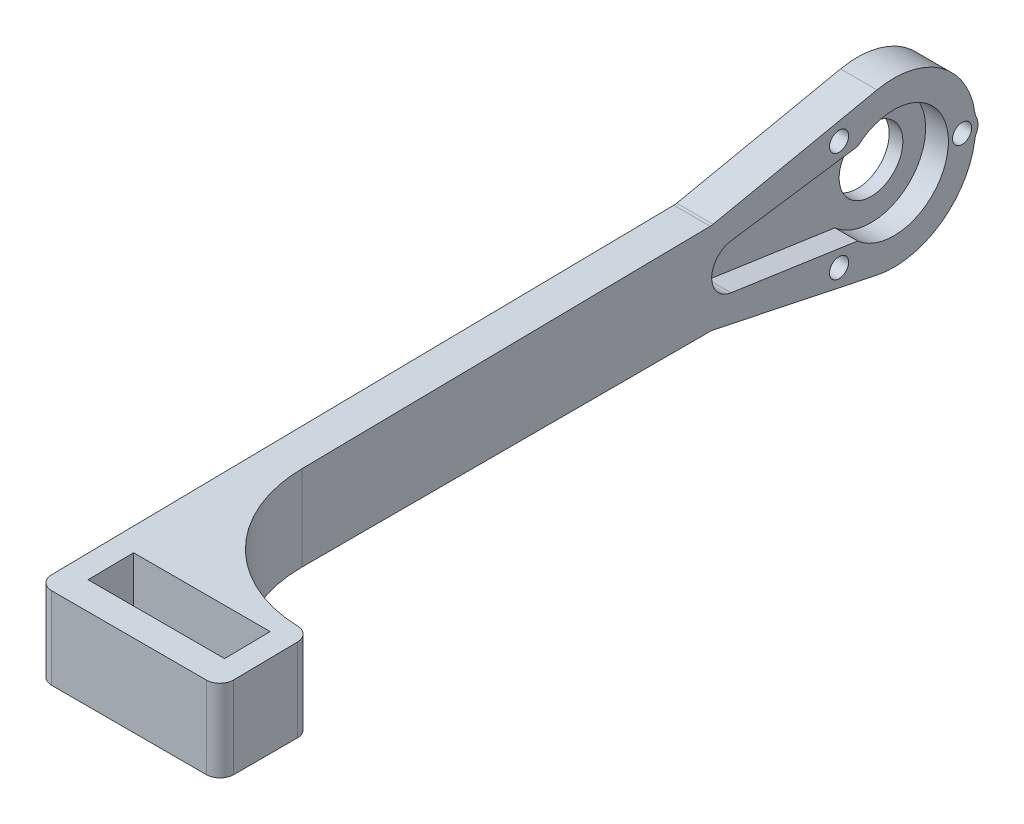
from build123d import *

# Parameters (mm, degrees)
BOSS_EXTRU_1_DEPTH           = 4
ESQUISSE2_R                  = 3.5
ENL_V_MAT_EXTRU_1_DEPTH      = 10
ENL_V_MAT_EXTRU_2_DEPTH      = 2.5
ESQUISSE5_R                  = 1.05
ENL_V_MAT_EXTRU_3_DEPTH      = 61.062987771
ESQUISSE6_W                  = 20
ESQUISSE6_H                  = 10
BOSS_EXTRU_2_DEPTH           = 10
ESQUISSE7_W                  = 15
ESQUISSE7_H                  = 5
ENL_V_MAT_EXTRU_4_DEPTH      = 10
CONG_2_R                     = 1.5
CONG_3_R                     = 15
ENL_V_MAT_EXTRU_5_DEPTH      = 64.178813835
ENL_V_MAT_EXTRU_5_DEPTH_BACK = 64.178813835


with BuildPart() as part:
    # Esquisse1 → Boss.-Extru.1 (new body)
    with BuildSketch(Plane(origin=(0, 0, 0), x_dir=(0, 0, -1), z_dir=(1, 0, 0))):
        with BuildLine():
            Line((30, 5), (-30, 5))
            Line((-30, 5), (-30, -5))
            Line((-30, -5), (30, -5))
            Line((30, -5), (48.152060387, -8.808241549))
            ThreePointArc((48.152060387, -8.808241549), (55.281301679, -7.28751347), (58.945833333, -0.985934061))
            ThreePointArc((58.945833333, -0.985934061), (59.25, 0), (58.945833333, 0.985934061))
            ThreePointArc((58.945833333, 0.985934061), (55.281301679, 7.28751347), (48.152060387, 8.808241549))
            Line((48.152060387, 8.808241549), (30, 5))
        make_face()
    extrude(amount=BOSS_EXTRU_1_DEPTH)

    # Esquisse2 → Enlèv. mat.-Extru.1 (cut)
    with BuildSketch(Plane(origin=(4, 0, 0), x_dir=(0, 0, -1), z_dir=(1, 0, 0))):
        with Locations((50, 0)):
            Circle(ESQUISSE2_R)
    extrude(amount=-ENL_V_MAT_EXTRU_1_DEPTH, mode=Mode.SUBTRACT)

    # Esquisse3 → Enlèv. mat.-Extru.2 (cut)
    with BuildSketch(Plane(origin=(4, 0, 0), x_dir=(0, 0, -1), z_dir=(1, 0, 0))):
        with BuildLine():
            Line((32.139192589, 2.473826593), (46.031373033, 4.5))
            ThreePointArc((46.031373033, 4.5), (56, 0), (46.031373033, -4.5))
            Line((46.031373033, -4.5), (32.139192589, -2.473826593))
            ThreePointArc((32.139192589, -2.473826593), (30, 0), (32.139192589, 2.473826593))
        make_face()
    extrude(amount=-ENL_V_MAT_EXTRU_2_DEPTH, mode=Mode.SUBTRACT)

    # Esquisse5 → Enlèv. mat.-Extru.3 (cut, through all)
    with BuildSketch(Plane(origin=(4, 0, 0), x_dir=(0, 0, -1), z_dir=(1, 0, 0))):
        with Locations((43.98959236, 6.01040764)):
            Circle(ESQUISSE5_R)
        with Locations((43.98959236, -6.01040764)):
            Circle(ESQUISSE5_R)
        with Locations((57.5, 0)):
            Circle(ESQUISSE5_R)
    extrude(amount=-ENL_V_MAT_EXTRU_3_DEPTH, mode=Mode.SUBTRACT)

    # Esquisse6 → Boss.-Extru.2 (add)
    with BuildSketch(Plane.XY.offset(30)):
        with Locations((10, 0)):
            Rectangle(ESQUISSE6_W, ESQUISSE6_H)
    extrude(amount=BOSS_EXTRU_2_DEPTH)

    # Esquisse7 → Enlèv. mat.-Extru.4 (cut)
    with BuildSketch(Plane(origin=(0, 5, 0), x_dir=(1, 0, 0), z_dir=(0, 1, 0))):
        with Locations((10, -34.5)):
            Rectangle(ESQUISSE7_W, ESQUISSE7_H)
    extrude(amount=-ENL_V_MAT_EXTRU_4_DEPTH, mode=Mode.SUBTRACT)

    # Congé2
    cong_2_edges = [part.edges().sort_by_distance(p)[0] for p in [
        (2, 0.985934061, -58.945833333),
        (2, -0.985934061, -58.945833333),
        (2, 5, -30),
        (2, -5, -30),
        (20, 0, 30),
        (20, 0, 40),
        (0, 0, 40),
    ]]
    fillet(cong_2_edges, radius=CONG_2_R)

    # Congé3
    cong_3_edges = [part.edges().sort_by_distance(p)[0] for p in [
        (4, 0, 30),
    ]]
    fillet(cong_3_edges, radius=CONG_3_R)

    # Esquisse8 → Enlèv. mat.-Extru.5 (cut, two sides: drawn at the far end of the back side and taken through both)
    with BuildSketch(Plane(origin=(20, 0, 0), x_dir=(0, 0, -1), z_dir=(1, 0, 0)).offset(-ENL_V_MAT_EXTRU_5_DEPTH_BACK)):
        Polygon((-40, 5), (-40, 4), (29.84434682, 5), align=None)
    extrude(amount=ENL_V_MAT_EXTRU_5_DEPTH + ENL_V_MAT_EXTRU_5_DEPTH_BACK, mode=Mode.SUBTRACT)


solid = part.part
